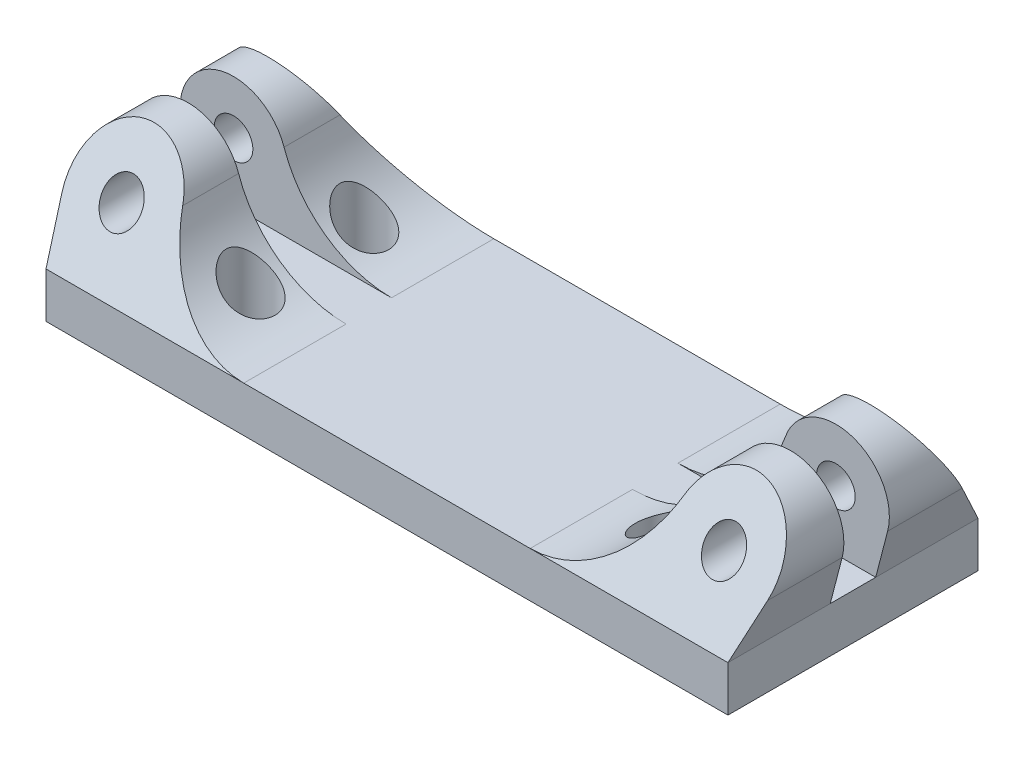
from build123d import *

# Parameters (mm, degrees)
SKETCH1_W               = 60
SKETCH1_H               = 22
SKETCH1_R               = 2.15
BOSS_EXTRUDE1_DEPTH     = 4
SKETCH2_R               = 1.7
BOSS_EXTRUDE2_DEPTH     = 9
CUT_EXTRUDE1_DEPTH      = 34
MIRROR5_COPY_1_SKETCH_R = 1.7
MIRROR5_COPY_1_DEPTH    = 9
MIRROR5_COPY_2_DEPTH    = 34
FILLET1_START           = -11.0000001
FILLET1_DEPTH           = 9.0000001
FILLET1_START_2         = 2
FILLET1_2_DEPTH         = 9
FILLET1_START_3         = 4
FILLET1_3_OUTLINE_R     = 2.15
FILLET1_3_DEPTH         = 4.037755723
FILLET1_START_4         = -30
FILLET1_4_DEPTH         = 60


with BuildPart() as part:
    # Sketch1 → Boss-Extrude1 (new body)
    with BuildSketch(Plane(origin=(0, 0, 0), x_dir=(1, 0, 0), z_dir=(0, 1, 0))):
        Rectangle(SKETCH1_W, SKETCH1_H)
        with Locations(Location((-18, 5, 0), (0, 0, 270))):
            Circle(SKETCH1_R, mode=Mode.SUBTRACT)
        with Locations(Location((-18, -5, 0), (0, 0, 270))):
            Circle(SKETCH1_R, mode=Mode.SUBTRACT)
        with Locations(Location((18, 5, 0), (0, 0, 90))):
            Circle(SKETCH1_R, mode=Mode.SUBTRACT)
        with Locations(Location((18, -5, 0), (0, 0, 90))):
            Circle(SKETCH1_R, mode=Mode.SUBTRACT)
    extrude(amount=BOSS_EXTRUDE1_DEPTH)

    # Sketch2 → Boss-Extrude2 (add)
    with BuildSketch(Plane.XY.offset(2)):
        with BuildLine():
            Line((-30, 4), (-31.048991933, 8.037755723))
            ThreePointArc((-31.048991933, 8.037755723), (-26.5, 13.919564671), (-21.951008067, 8.037755723))
            Line((-21.951008067, 8.037755723), (-23, 4))
            Line((-23, 4), (-30, 4))
        make_face()
        with Locations((-26.5, 9.219564671)):
            Circle(SKETCH2_R, mode=Mode.SUBTRACT)
    boss_extrude2 = extrude(amount=BOSS_EXTRUDE2_DEPTH)

    # Sketch3 → Cut-Extrude1 (cut)
    with BuildSketch(Plane(origin=(0, 0, 0), x_dir=(0, 0, -1), z_dir=(1, 0, 0))):
        Polygon((-5, 13.919564671), (-11, 4), (-11, 13.919564671), align=None)
    cut_extrude1 = extrude(amount=-CUT_EXTRUDE1_DEPTH, mode=Mode.SUBTRACT)

    # Mirror4: Boss-Extrude2, Cut-Extrude1 across plane
    add(boss_extrude2.mirror(Plane.XY))
    add(cut_extrude1.mirror(Plane.XY), mode=Mode.SUBTRACT)

    # Mirror5: Boss-Extrude2, Cut-Extrude1 across plane
    add(boss_extrude2.mirror(Plane(origin=(0, 0, 0), x_dir=(0, 0, 1), z_dir=(1, 0, 0))))
    add(cut_extrude1.mirror(Plane(origin=(0, 0, 0), x_dir=(0, 0, 1), z_dir=(1, 0, 0))), mode=Mode.SUBTRACT)

    # Mirror5 copy 1 sketch → Mirror5 copy 1 (add)
    with BuildSketch(Plane(origin=(0, 0, -2), x_dir=(-1, 0, 0), z_dir=(0, 0, -1))):
        with BuildLine():
            Line((-30, 4), (-31.048991933, 8.037755723))
            ThreePointArc((-31.048991933, 8.037755723), (-26.5, 13.919564671), (-21.951008067, 8.037755723))
            Line((-21.951008067, 8.037755723), (-23, 4))
            Line((-23, 4), (-30, 4))
        make_face()
        with Locations((-26.5, 9.219564671)):
            Circle(MIRROR5_COPY_1_SKETCH_R, mode=Mode.SUBTRACT)
    extrude(amount=MIRROR5_COPY_1_DEPTH)

    # Mirror5 copy 2 sketch → Mirror5 copy 2 (cut)
    with BuildSketch(Plane.ZY):
        Polygon((-5, 13.919564671), (-11, 4), (-11, 13.919564671), align=None)
    extrude(amount=-MIRROR5_COPY_2_DEPTH, mode=Mode.SUBTRACT)

    # Fillet1: read off the stored shape, not the designer's step
    # Fillet1 outline → Fillet1 (add)
    with BuildSketch(Plane.XY.offset(FILLET1_START)):
        with BuildLine():
            ThreePointArc((21.951008067, 8.037755723), (21.80348703, 9.400578254), (22.055466759, 10.748003177))
            ThreePointArc((22.055466759, 10.748003177), (18.407628714, 5.859976406), (12.599013054, 4))
            Line((12.599013054, 4), (23, 4))
            Line((23, 4), (21.951008067, 8.037755723))
        make_face()
        with BuildLine():
            Line((-23, 4), (-12.599013054, 4))
            ThreePointArc((-12.599013054, 4), (-18.407628714, 5.859976406), (-22.055466759, 10.748003177))
            ThreePointArc((-22.055466759, 10.748003177), (-21.80348703, 9.400578254), (-21.951008067, 8.037755723))
            Line((-21.951008067, 8.037755723), (-23, 4))
        make_face()
    extrude(amount=FILLET1_DEPTH)

    # Fillet1 2 outline → Fillet1 2 (add)
    with BuildSketch(Plane.XY.offset(FILLET1_START_2)):
        with BuildLine():
            ThreePointArc((21.951008067, 8.037755723), (21.80348703, 9.400578254), (22.055466759, 10.748003177))
            ThreePointArc((22.055466759, 10.748003177), (18.407628714, 5.859976406), (12.599013054, 4))
            Line((12.599013054, 4), (23, 4))
            Line((23, 4), (21.951008067, 8.037755723))
        make_face()
        with BuildLine():
            Line((-23, 4), (-12.599013054, 4))
            ThreePointArc((-12.599013054, 4), (-18.407628714, 5.859976406), (-22.055466759, 10.748003177))
            ThreePointArc((-22.055466759, 10.748003177), (-21.80348703, 9.400578254), (-21.951008067, 8.037755723))
            Line((-21.951008067, 8.037755723), (-23, 4))
        make_face()
    extrude(amount=FILLET1_2_DEPTH)

    # Fillet1 3 outline → Fillet1 3 (cut)
    with BuildSketch(Plane(origin=(0, 0, 0), x_dir=(1, 0, 0), z_dir=(0, 1, 0)).offset(FILLET1_START_3)):
        with Locations((-18, -5)):
            Circle(FILLET1_3_OUTLINE_R)
        with Locations((-18, 5)):
            Circle(FILLET1_3_OUTLINE_R)
        with Locations((18, 5)):
            Circle(FILLET1_3_OUTLINE_R)
        with Locations((18, -5)):
            Circle(FILLET1_3_OUTLINE_R)
    extrude(amount=FILLET1_3_DEPTH, mode=Mode.SUBTRACT)

    # Fillet1 4 outline → Fillet1 4 (cut)
    with BuildSketch(Plane.YZ.offset(FILLET1_START_4)):
        Polygon((12, 11), (4, 11), (12, 6.161077971), align=None)
        Polygon((12, -11), (12, -6.161077971), (4, -11), align=None)
    extrude(amount=FILLET1_4_DEPTH, mode=Mode.SUBTRACT)


solid = part.part
